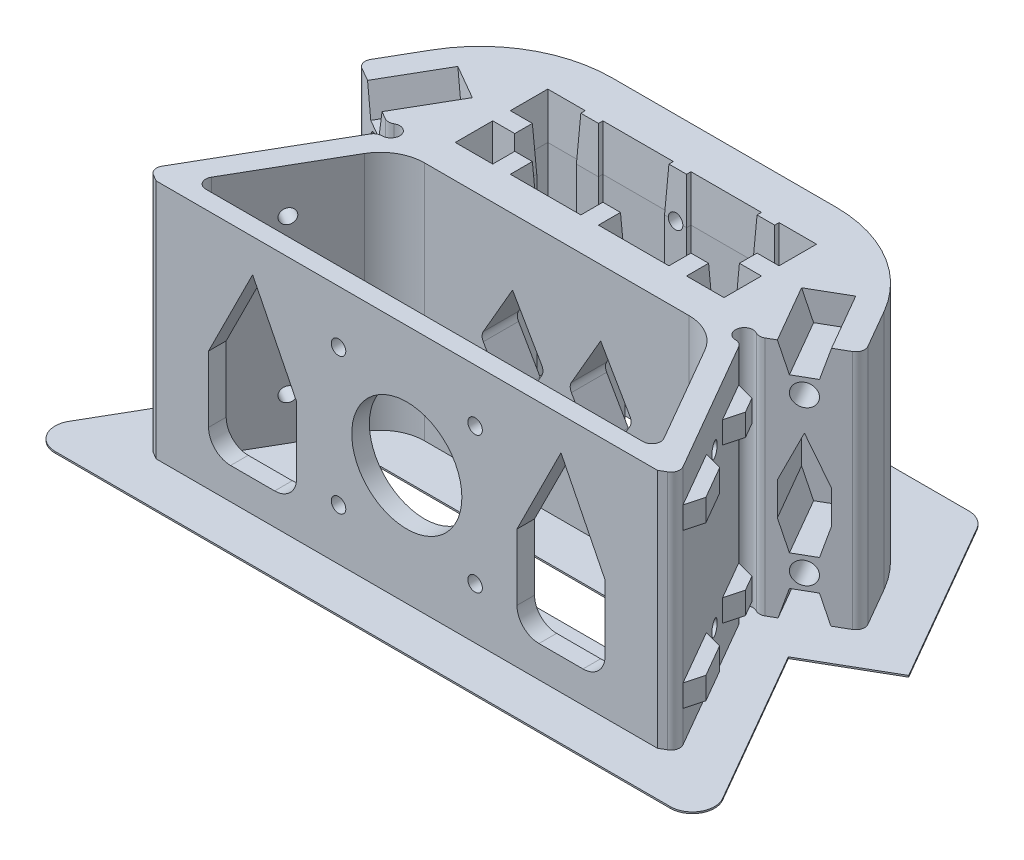
from build123d import *

# Parameters (mm, degrees)
BOSS_EXTRUDE1_DEPTH      = 55
SKETCH13_R               = 5
CUT_EXTRUDE7_DEPTH       = 106.913479808
SKETCH14_R               = 5
SKETCH14_R_2             = 2.5
BOSS_EXTRUDE8_DEPTH      = 16
CUT_EXTRUDE8_DEPTH       = 15
SKETCH16_W               = 14.535898385
SKETCH16_H               = 5
SKETCH16_W_2             = 10
BOSS_EXTRUDE9_DEPTH      = 3
CHAMFER2_SIZE            = 3
CUT_EXTRUDE9_REACH       = 121.348
SKETCH17_R               = 1.65
CHAMFER2_OF_MIRROR7_SIZE = 3
CUT_EXTRUDE10_REACH      = 111.206
SKETCH18_R               = 1.65
SKETCH19_R               = 6
CUT_EXTRUDE11_DEPTH      = 4
CUT_EXTRUDE12_REACH      = 91.963
SKETCH22_W               = 113.76755047
SKETCH22_H               = 0.641016151
CUT_EXTRUDE13_DEPTH      = 98.058374232
CUT_EXTRUDE14_REACH      = 110.781
SKETCH23_R               = 12.5
SKETCH23_R_2             = 1.65
FILLET1_R                = 5
BOSS_EXTRUDE10_DEPTH     = 0.35


with BuildPart() as part:
    # Sketch1 → Boss-Extrude1 (new body)
    with BuildSketch(Plane(origin=(0, 0, 0), x_dir=(1, 0, 0), z_dir=(0, 1, 0))):
        with BuildLine():
            Line((55.773502692, -52.641016151), (58.371578903, -51.141016151))
            ThreePointArc((58.371578903, -51.141016151), (59.303430556, -49.926603434), (59.103629711, -48.408965344))
            Line((59.103629711, -48.408965344), (41.835680518, -18.5))
            ThreePointArc((41.835680518, -18.5), (41.103629711, -17.767949192), (40.103629711, -17.5))
            ThreePointArc((40.103629711, -17.5), (38.171778058, -14.98236191), (41.103629711, -13.767949192))
            ThreePointArc((41.103629711, -13.767949192), (42.103629711, -14.035898385), (43.103629711, -13.767949192))
            Line((43.103629711, -13.767949192), (55.692086979, -6.5))
            ThreePointArc((55.692086979, -6.5), (56.623938632, -5.285587283), (56.424137787, -3.767949192))
            Line((56.424137787, -3.767949192), (51.36195996, 5))
            ThreePointArc((51.36195996, 5), (40.381197846, 15.980762114), (25.381197846, 20))
            Line((25.381197846, 20), (-25.381197846, 20))
            ThreePointArc((-25.381197846, 20), (-40.381197846, 15.980762114), (-51.36195996, 5))
            Line((-51.36195996, 5), (-56.424137787, -3.767949192))
            ThreePointArc((-56.424137787, -3.767949192), (-56.623938632, -5.285587283), (-55.692086979, -6.5))
            Line((-55.692086979, -6.5), (-43.103629711, -13.767949192))
            ThreePointArc((-43.103629711, -13.767949192), (-42.103629711, -14.035898385), (-41.103629711, -13.767949192))
            ThreePointArc((-41.103629711, -13.767949192), (-38.171778058, -14.98236191), (-40.103629711, -17.5))
            ThreePointArc((-40.103629711, -17.5), (-41.103629711, -17.767949192), (-41.835680518, -18.5))
            Line((-41.835680518, -18.5), (-59.103629711, -48.408965344))
            ThreePointArc((-59.103629711, -48.408965344), (-59.303430556, -49.926603434), (-58.371578903, -51.141016151))
            Line((-58.371578903, -51.141016151), (-55.773502692, -52.641016151))
            Line((-55.773502692, -52.641016151), (-55.692086979, -52.5))
            ThreePointArc((-55.692086979, -52.5), (-55.326061575, -52.133974596), (-54.826061575, -52))
            Line((-54.826061575, -52), (54.826061575, -52))
            ThreePointArc((54.826061575, -52), (55.326061575, -52.133974596), (55.692086979, -52.5))
            Line((55.692086979, -52.5), (55.773502692, -52.641016151))
        make_face()
        with BuildLine():
            Line((-30, -18), (30, -18))
            ThreePointArc((30, -18), (35, -19.339745962), (38.660254038, -23))
            Line((38.660254038, -23), (51.36195996, -45))
            ThreePointArc((51.36195996, -45), (51.36195996, -47), (49.629909152, -48))
            Line((49.629909152, -48), (-49.629909152, -48))
            ThreePointArc((-49.629909152, -48), (-51.36195996, -47), (-51.36195996, -45))
            Line((-51.36195996, -45), (-38.660254038, -23))
            ThreePointArc((-38.660254038, -23), (-35, -19.339745962), (-30, -18))
        make_face(mode=Mode.SUBTRACT)
        Polygon((-30, 10), (-22.5, 10), (-22.5, 9), (-17.5, 9), (-17.5, 10), (-2.5, 10), (-2.5, 9), (2.5, 9), (2.5, 10), (17.5, 10), (17.5, 9), (22.5, 9), (22.5, 10), (30, 10), (30, 2.5), (25, 2.5), (25, -2.5), (30, -2.5), (30, -10), (22.5, -10), (22.5, -5), (17.5, -5), (17.5, -10), (2.5, -10), (2.5, -5), (-2.5, -5), (-2.5, -10), (-17.5, -10), (-17.5, -5), (-22.5, -5), (-22.5, -10), (-30, -10), (-30, -2.5), (-25, -2.5), (-25, 2.5), (-30, 2.5), align=None, mode=Mode.SUBTRACT)
    extrude(amount=BOSS_EXTRUDE1_DEPTH)

    # Sketch13 → Cut-Extrude7 (cut, through all)
    with BuildSketch(Plane(origin=(16.737604307, 0, 28.990381057), x_dir=(0.8660254037844353, 0, -0.500000000000006), z_dir=(0.500000000000006, 0, 0.8660254037844353))):
        with Locations((36.980762114, 10)):
            Circle(SKETCH13_R)
        with Locations((36.980762114, 45)):
            Circle(SKETCH13_R)
    cut_extrude7 = extrude(amount=-CUT_EXTRUDE7_DEPTH, mode=Mode.SUBTRACT)

    # Sketch14 → Boss-Extrude8 (add)
    # profile 1 of 2: a face of its own
    with BuildSketch(Plane(origin=(16.737604307, 0, 28.990381057), x_dir=(0.8660254037844353, 0, -0.500000000000006), z_dir=(0.500000000000006, 0, 0.8660254037844353))):
        with Locations((36.980762114, 45)):
            Circle(SKETCH14_R)
        with Locations((36.980762114, 45)):
            Circle(SKETCH14_R_2, mode=Mode.SUBTRACT)
    # profile 2 of 2: a face of its own
    with BuildSketch(Plane(origin=(16.737604307, 0, 28.990381057), x_dir=(0.8660254037844353, 0, -0.500000000000006), z_dir=(0.500000000000006, 0, 0.8660254037844353))):
        with Locations((36.980762114, 10)):
            Circle(SKETCH14_R)
        with Locations((36.980762114, 10)):
            Circle(SKETCH14_R_2, mode=Mode.SUBTRACT)
    boss_extrude8 = extrude(amount=-BOSS_EXTRUDE8_DEPTH)

    # Sketch15 → Cut-Extrude8 (cut)
    with BuildSketch(Plane(origin=(16.737604307, 0, 28.990381057), x_dir=(0.8660254037844353, 0, -0.500000000000006), z_dir=(0.500000000000006, 0, 0.8660254037844353))):
        Polygon((32.480762114, 55), (34.480762114, 48.5), (39.480762114, 48.5), (41.480762114, 55), align=None)
        Polygon((39.480762114, 6.5), (41.480762114, 0), (32.480762114, 0), (34.480762114, 6.5), align=None)
        Polygon((41.480762114, 20), (41.480762114, 27.5), (36.980762114, 37.5), (32.480762114, 27.5), (32.480762114, 20), (34.480762114, 13.5), (39.480762114, 13.5), align=None)
    cut_extrude8 = extrude(amount=-CUT_EXTRUDE8_DEPTH, mode=Mode.SUBTRACT)

    # Sketch16 → Boss-Extrude9 (add)
    with BuildSketch(Plane(origin=(23.366025404, 0, -13.490381057), x_dir=(-0.5000000000000017, 0, -0.8660254037844377), z_dir=(0.8660254037844377, 0, -0.5000000000000017))):
        with Locations((-64.207259421, 10)):
            Rectangle(SKETCH16_W, SKETCH16_H)
        with Locations((-41.939310229, 10)):
            Rectangle(SKETCH16_W_2, SKETCH16_H)
        with Locations((-64.207259421, 45)):
            Rectangle(SKETCH16_W, SKETCH16_H)
        with Locations((-41.939310229, 45)):
            Rectangle(SKETCH16_W_2, SKETCH16_H)
    boss_extrude9 = extrude(amount=BOSS_EXTRUDE9_DEPTH)

    # Chamfer2
    chamfer2_edges = [part.edges().sort_by_distance(p)[0] for p in [
        (44.43375673, 45, 17),
        (44.43375673, 10, 17),
        (49.43375673, 10, 25.660254038),
        (49.43375673, 45, 25.660254038),
        (54.43375673, 45, 34.320508076),
        (54.43375673, 10, 34.320508076),
        (61.701705922, 10, 46.908965344),
        (61.701705922, 45, 46.908965344),
    ]]
    chamfer(chamfer2_edges, length=CHAMFER2_SIZE - 0.0001)  # a hair under: the kernel refuses the full size

    # Sketch17 → Cut-Extrude9 (cut, up to next)
    with BuildSketch(Plane(origin=(23.366025404, 0, -13.490381057), x_dir=(-0.5000000000000017, 0, -0.8660254037844377), z_dir=(0.8660254037844377, 0, -0.5000000000000017)), mode=Mode.PRIVATE) as cut_extrude9_sk1:
        with Locations((-51.939310229, 10)):
            Circle(SKETCH17_R)
    cut_extrude9_tool1 = extrude(cut_extrude9_sk1.sketch, amount=-CUT_EXTRUDE9_REACH, mode=Mode.PRIVATE) & part.part
    # Sketch17 → Cut-Extrude9 (cut, up to next)
    with BuildSketch(Plane(origin=(23.366025404, 0, -13.490381057), x_dir=(-0.5000000000000017, 0, -0.8660254037844377), z_dir=(0.8660254037844377, 0, -0.5000000000000017)), mode=Mode.PRIVATE) as cut_extrude9_sk2:
        with Locations((-51.939310229, 45)):
            Circle(SKETCH17_R)
    cut_extrude9_tool2 = extrude(cut_extrude9_sk2.sketch, amount=-CUT_EXTRUDE9_REACH, mode=Mode.PRIVATE) & part.part
    cut_extrude9_1 = cut_extrude9_tool1.solids().sort_by_distance((49.335681, 10, 31.490381))[0]
    add(cut_extrude9_1, mode=Mode.SUBTRACT)
    cut_extrude9_2 = cut_extrude9_tool2.solids().sort_by_distance((49.335681, 45, 31.490381))[0]
    add(cut_extrude9_2, mode=Mode.SUBTRACT)
    cut_extrude9 = cut_extrude9_1 + cut_extrude9_2  # Cut-Extrude9 as one shape, for the pattern or mirror that repeats it

    # Mirror7: Cut-Extrude7, Boss-Extrude8, Cut-Extrude8, Boss-Extrude9, Cut-Extrude9 across plane
    add(cut_extrude7.mirror(Plane(origin=(0, 0, 0), x_dir=(0, 0, 1), z_dir=(1, 0, 0))), mode=Mode.SUBTRACT)
    add(boss_extrude8.mirror(Plane(origin=(0, 0, 0), x_dir=(0, 0, 1), z_dir=(1, 0, 0))))
    add(cut_extrude8.mirror(Plane(origin=(0, 0, 0), x_dir=(0, 0, 1), z_dir=(1, 0, 0))), mode=Mode.SUBTRACT)
    add(boss_extrude9.mirror(Plane(origin=(0, 0, 0), x_dir=(0, 0, 1), z_dir=(1, 0, 0))))
    add(cut_extrude9.mirror(Plane(origin=(0, 0, 0), x_dir=(0, 0, 1), z_dir=(1, 0, 0))), mode=Mode.SUBTRACT)

    # Chamfer2 of Mirror7
    chamfer2_of_mirror7_edges = [part.edges().sort_by_distance(p)[0] for p in [
        (-44.43375673, 45, 17),
        (-44.43375673, 10, 17),
        (-49.43375673, 10, 25.660254038),
        (-49.43375673, 45, 25.660254038),
        (-54.43375673, 45, 34.320508076),
        (-54.43375673, 10, 34.320508076),
        (-61.701705922, 10, 46.908965344),
        (-61.701705922, 45, 46.908965344),
    ]]
    chamfer(chamfer2_of_mirror7_edges, length=CHAMFER2_OF_MIRROR7_SIZE - 0.0001)  # a hair under: the kernel refuses the full size

    # Sketch18 → Cut-Extrude10 (cut, up to next)
    with BuildSketch(Plane(origin=(0, 0, -20), x_dir=(-1, 0, 0), z_dir=(0, 0, -1)), mode=Mode.PRIVATE) as cut_extrude10_sk1:
        with Locations((0, 45)):
            Circle(SKETCH18_R)
    cut_extrude10_tool1 = extrude(cut_extrude10_sk1.sketch, amount=-CUT_EXTRUDE10_REACH, mode=Mode.PRIVATE) & part.part
    # Sketch18 → Cut-Extrude10 (cut, up to next)
    with BuildSketch(Plane(origin=(0, 0, -20), x_dir=(-1, 0, 0), z_dir=(0, 0, -1)), mode=Mode.PRIVATE) as cut_extrude10_sk2:
        with Locations((0, 10)):
            Circle(SKETCH18_R)
    cut_extrude10_tool2 = extrude(cut_extrude10_sk2.sketch, amount=-CUT_EXTRUDE10_REACH, mode=Mode.PRIVATE) & part.part
    # Sketch18 → Cut-Extrude10 (cut, up to next)
    with BuildSketch(Plane(origin=(0, 0, -20), x_dir=(-1, 0, 0), z_dir=(0, 0, -1)), mode=Mode.PRIVATE) as cut_extrude10_sk3:
        with Locations((-20, 27.5)):
            Circle(SKETCH18_R)
    cut_extrude10_tool3 = extrude(cut_extrude10_sk3.sketch, amount=-CUT_EXTRUDE10_REACH, mode=Mode.PRIVATE) & part.part
    # Sketch18 → Cut-Extrude10 (cut, up to next)
    with BuildSketch(Plane(origin=(0, 0, -20), x_dir=(-1, 0, 0), z_dir=(0, 0, -1)), mode=Mode.PRIVATE) as cut_extrude10_sk4:
        with Locations((20, 27.5)):
            Circle(SKETCH18_R)
    cut_extrude10_tool4 = extrude(cut_extrude10_sk4.sketch, amount=-CUT_EXTRUDE10_REACH, mode=Mode.PRIVATE) & part.part
    add(cut_extrude10_tool1.solids().sort_by_distance((0, 45, -20))[0], mode=Mode.SUBTRACT)
    add(cut_extrude10_tool2.solids().sort_by_distance((0, 10, -20))[0], mode=Mode.SUBTRACT)
    add(cut_extrude10_tool3.solids().sort_by_distance((20, 27.5, -20))[0], mode=Mode.SUBTRACT)
    add(cut_extrude10_tool4.solids().sort_by_distance((-20, 27.5, -20))[0], mode=Mode.SUBTRACT)

    # Sketch19 → Cut-Extrude11 (cut)
    with BuildSketch(Plane(origin=(0, 0, -20), x_dir=(-1, 0, 0), z_dir=(0, 0, -1))):
        with Locations((0, 45)):
            Circle(SKETCH19_R)
        with Locations(Location((20, 27.5, 0), (0, 0, 26.250833445))):
            Circle(SKETCH19_R)
        with Locations((0, 10)):
            Circle(SKETCH19_R)
        with Locations(Location((-20, 27.5, 0), (0, 0, 206.250833445))):
            Circle(SKETCH19_R)
    extrude(amount=-CUT_EXTRUDE11_DEPTH, mode=Mode.SUBTRACT)

    # Sketch20 → Cut-Extrude12 (cut, up to next)
    with BuildSketch(Plane.XY.offset(18), mode=Mode.PRIVATE) as cut_extrude12_sk1:
        with BuildLine():
            Line((-10, 40), (-16.639528096, 28.5))
            ThreePointArc((-16.639528096, 28.5), (-16.907477288, 27.5), (-16.639528096, 26.5))
            Line((-16.639528096, 26.5), (-11.732050808, 18))
            ThreePointArc((-11.732050808, 18), (-10, 17), (-8.267949192, 18))
            Line((-8.267949192, 18), (-3.360471904, 26.5))
            ThreePointArc((-3.360471904, 26.5), (-3.092522712, 27.5), (-3.360471904, 28.5))
            Line((-3.360471904, 28.5), (-10, 40))
        make_face()
    cut_extrude12_tool1 = extrude(cut_extrude12_sk1.sketch, amount=-CUT_EXTRUDE12_REACH, mode=Mode.PRIVATE) & part.part
    # Sketch20 → Cut-Extrude12 (cut, up to next)
    with BuildSketch(Plane.XY.offset(18), mode=Mode.PRIVATE) as cut_extrude12_sk2:
        with BuildLine():
            Line((3.360471904, 28.5), (10, 40))
            Line((10, 40), (16.639528096, 28.5))
            ThreePointArc((16.639528096, 28.5), (16.907477288, 27.5), (16.639528096, 26.5))
            Line((16.639528096, 26.5), (11.732050808, 18))
            ThreePointArc((11.732050808, 18), (10, 17), (8.267949192, 18))
            Line((8.267949192, 18), (3.360471904, 26.5))
            ThreePointArc((3.360471904, 26.5), (3.092522712, 27.5), (3.360471904, 28.5))
        make_face()
    cut_extrude12_tool2 = extrude(cut_extrude12_sk2.sketch, amount=-CUT_EXTRUDE12_REACH, mode=Mode.PRIVATE) & part.part
    add(cut_extrude12_tool1.solids().sort_by_distance((-10, 27.670453, 18))[0], mode=Mode.SUBTRACT)
    add(cut_extrude12_tool2.solids().sort_by_distance((10, 27.670453, 18))[0], mode=Mode.SUBTRACT)

    # Sketch22 → Cut-Extrude13 (cut, through all)
    with BuildSketch(Plane(origin=(0, 55, 0), x_dir=(1, 0, 0), z_dir=(0, 1, 0))):
        with Locations((0, -52.320508076)):
            Rectangle(SKETCH22_W, SKETCH22_H)
    extrude(amount=-CUT_EXTRUDE13_DEPTH, mode=Mode.SUBTRACT)

    # Sketch23 → Cut-Extrude14 (cut, up to next)
    with BuildSketch(Plane.XY.offset(52), mode=Mode.PRIVATE) as cut_extrude14_sk1:
        with Locations((0, 27.5)):
            Circle(SKETCH23_R)
    cut_extrude14_tool1 = extrude(cut_extrude14_sk1.sketch, amount=-CUT_EXTRUDE14_REACH, mode=Mode.PRIVATE) & part.part
    # Sketch23 → Cut-Extrude14 (cut, up to next)
    with BuildSketch(Plane.XY.offset(52), mode=Mode.PRIVATE) as cut_extrude14_sk2:
        with Locations((-15.5, 12)):
            Circle(SKETCH23_R_2)
    cut_extrude14_tool2 = extrude(cut_extrude14_sk2.sketch, amount=-CUT_EXTRUDE14_REACH, mode=Mode.PRIVATE) & part.part
    # Sketch23 → Cut-Extrude14 (cut, up to next)
    with BuildSketch(Plane.XY.offset(52), mode=Mode.PRIVATE) as cut_extrude14_sk3:
        with Locations((15.5, 12)):
            Circle(SKETCH23_R_2)
    cut_extrude14_tool3 = extrude(cut_extrude14_sk3.sketch, amount=-CUT_EXTRUDE14_REACH, mode=Mode.PRIVATE) & part.part
    # Sketch23 → Cut-Extrude14 (cut, up to next)
    with BuildSketch(Plane.XY.offset(52), mode=Mode.PRIVATE) as cut_extrude14_sk4:
        with Locations((15.5, 43)):
            Circle(SKETCH23_R_2)
    cut_extrude14_tool4 = extrude(cut_extrude14_sk4.sketch, amount=-CUT_EXTRUDE14_REACH, mode=Mode.PRIVATE) & part.part
    # Sketch23 → Cut-Extrude14 (cut, up to next)
    with BuildSketch(Plane.XY.offset(52), mode=Mode.PRIVATE) as cut_extrude14_sk5:
        with Locations((-15.5, 43)):
            Circle(SKETCH23_R_2)
    cut_extrude14_tool5 = extrude(cut_extrude14_sk5.sketch, amount=-CUT_EXTRUDE14_REACH, mode=Mode.PRIVATE) & part.part
    # Sketch23 → Cut-Extrude14 (cut, up to next)
    with BuildSketch(Plane.XY.offset(52), mode=Mode.PRIVATE) as cut_extrude14_sk6:
        Polygon((35, 47.5), (45, 27.5), (45, 7.5), (25, 7.5), (25, 27.5), align=None)
    cut_extrude14_tool6 = extrude(cut_extrude14_sk6.sketch, amount=-CUT_EXTRUDE14_REACH, mode=Mode.PRIVATE) & part.part
    # Sketch23 → Cut-Extrude14 (cut, up to next)
    with BuildSketch(Plane.XY.offset(52), mode=Mode.PRIVATE) as cut_extrude14_sk7:
        Polygon((-45, 27.5), (-45, 7.5), (-25, 7.5), (-25, 27.5), (-35, 47.5), align=None)
    cut_extrude14_tool7 = extrude(cut_extrude14_sk7.sketch, amount=-CUT_EXTRUDE14_REACH, mode=Mode.PRIVATE) & part.part
    add(cut_extrude14_tool1.solids().sort_by_distance((0, 27.5, 52))[0], mode=Mode.SUBTRACT)
    add(cut_extrude14_tool2.solids().sort_by_distance((-15.5, 12, 52))[0], mode=Mode.SUBTRACT)
    add(cut_extrude14_tool3.solids().sort_by_distance((15.5, 12, 52))[0], mode=Mode.SUBTRACT)
    add(cut_extrude14_tool4.solids().sort_by_distance((15.5, 43, 52))[0], mode=Mode.SUBTRACT)
    add(cut_extrude14_tool5.solids().sort_by_distance((-15.5, 43, 52))[0], mode=Mode.SUBTRACT)
    add(cut_extrude14_tool6.solids().sort_by_distance((35, 23.055556, 52))[0], mode=Mode.SUBTRACT)
    add(cut_extrude14_tool7.solids().sort_by_distance((-35, 23.055556, 52))[0], mode=Mode.SUBTRACT)

    # Fillet1
    fillet1_edges = [part.edges().sort_by_distance(p)[0] for p in [
        (45, 7.5, 50),
        (25, 7.5, 50),
        (-25, 7.5, 50),
        (-45, 7.5, 50),
    ]]
    fillet(fillet1_edges, radius=FILLET1_R)

    # Chamfer3: read off the stored shape, not the designer's step
    # Chamfer3: loft between two sections, ruled curve by curve
    chamfer3_from = [
        Edge.make_line((30, 45, 10), (30, 45, 2.5)),
        Edge.make_line((30, 45, -2.5), (30, 45, -10)),
        Edge.make_line((30, 45, 2.5), (25, 45, 2.5)),
        Edge.make_line((-30, 45, 2.5), (-25, 45, 2.5)),
        Edge.make_line((30, 45, 10), (22.5, 45, 10)),
        Edge.make_line((17.5, 45, 10), (2.5, 45, 10)),
        Edge.make_line((-2.5, 45, 10), (-17.5, 45, 10)),
        Edge.make_line((-22.5, 45, 10), (-30, 45, 10)),
        Edge.make_line((25, 45, 2.5), (25, 45, -2.5)),
        Edge.make_line((22.5, 45, 10), (22.5, 45, 5)),
        Edge.make_line((22.5, 45, -10), (22.5, 45, -9)),
        Edge.make_line((25, 45, -2.5), (30, 45, -2.5)),
        Edge.make_line((-25, 45, -2.5), (-30, 45, -2.5)),
        Edge.make_line((22.5, 45, 5), (17.5, 45, 5)),
        Edge.make_line((2.5, 45, 5), (-2.5, 45, 5)),
        Edge.make_line((-17.5, 45, 5), (-22.5, 45, 5)),
        Edge.make_line((17.5, 45, 5), (17.5, 45, 10)),
        Edge.make_line((17.5, 45, -9), (17.5, 45, -10)),
        Edge.make_line((30, 45, -10), (22.5, 45, -10)),
        Edge.make_line((17.5, 45, -10), (2.5, 45, -10)),
        Edge.make_line((-2.5, 45, -10), (-17.5, 45, -10)),
        Edge.make_line((-22.5, 45, -10), (-30, 45, -10)),
        Edge.make_line((2.5, 45, 10), (2.5, 45, 5)),
        Edge.make_line((2.5, 45, -10), (2.5, 45, -9)),
        Edge.make_line((22.5, 45, -9), (17.5, 45, -9)),
        Edge.make_line((-17.5, 45, -9), (-22.5, 45, -9)),
        Edge.make_line((-2.5, 45, 5), (-2.5, 45, 10)),
        Edge.make_line((-2.5, 45, -9), (-2.5, 45, -10)),
        Edge.make_line((-17.5, 45, 10), (-17.5, 45, 5)),
        Edge.make_line((-17.5, 45, -10), (-17.5, 45, -9)),
        Edge.make_line((-22.5, 45, 5), (-22.5, 45, 10)),
        Edge.make_line((-22.5, 45, -9), (-22.5, 45, -10)),
        Edge.make_line((-30, 45, 10), (-30, 45, 2.5)),
        Edge.make_line((-30, 45, -10), (-30, 45, -2.5)),
        Edge.make_line((-25, 45, 2.5), (-25, 45, -2.5)),
        Edge.make_line((-2.5, 45, -9), (2.5, 45, -9)),
    ]
    chamfer3_to = [
        Edge.make_line((30.5, 55, 10.5), (30.5, 55, 2)),
        Edge.make_line((30.5, 55, -2), (30.5, 55, -10.5)),
        Edge.make_line((30.5, 55, 2), (25.5, 55, 2)),
        Edge.make_line((-30.5, 55, 2), (-25.5, 55, 2)),
        Edge.make_line((30.5, 55, 10.5), (22, 55, 10.5)),
        Edge.make_line((18, 55, 10.5), (2, 55, 10.5)),
        Edge.make_line((-2, 55, 10.5), (-18, 55, 10.5)),
        Edge.make_line((-22, 55, 10.5), (-30.5, 55, 10.5)),
        Edge.make_line((25.5, 55, 2), (25.5, 55, -2)),
        Edge.make_line((22, 55, 10.5), (22, 55, 5.5)),
        Edge.make_line((22, 55, -10.5), (22, 55, -9.5)),
        Edge.make_line((25.5, 55, -2), (30.5, 55, -2)),
        Edge.make_line((-25.5, 55, -2), (-30.5, 55, -2)),
        Edge.make_line((22, 55, 5.5), (18, 55, 5.5)),
        Edge.make_line((2, 55, 5.5), (-2, 55, 5.5)),
        Edge.make_line((-18, 55, 5.5), (-22, 55, 5.5)),
        Edge.make_line((18, 55, 5.5), (18, 55, 10.5)),
        Edge.make_line((18, 55, -9.5), (18, 55, -10.5)),
        Edge.make_line((30.5, 55, -10.5), (22, 55, -10.5)),
        Edge.make_line((18, 55, -10.5), (2, 55, -10.5)),
        Edge.make_line((-2, 55, -10.5), (-18, 55, -10.5)),
        Edge.make_line((-22, 55, -10.5), (-30.5, 55, -10.5)),
        Edge.make_line((2, 55, 10.5), (2, 55, 5.5)),
        Edge.make_line((2, 55, -10.5), (2, 55, -9.5)),
        Edge.make_line((22, 55, -9.5), (18, 55, -9.5)),
        Edge.make_line((-18, 55, -9.5), (-22, 55, -9.5)),
        Edge.make_line((-2, 55, 5.5), (-2, 55, 10.5)),
        Edge.make_line((-2, 55, -9.5), (-2, 55, -10.5)),
        Edge.make_line((-18, 55, 10.5), (-18, 55, 5.5)),
        Edge.make_line((-18, 55, -10.5), (-18, 55, -9.5)),
        Edge.make_line((-22, 55, 5.5), (-22, 55, 10.5)),
        Edge.make_line((-22, 55, -9.5), (-22, 55, -10.5)),
        Edge.make_line((-30.5, 55, 10.5), (-30.5, 55, 2)),
        Edge.make_line((-30.5, 55, -10.5), (-30.5, 55, -2)),
        Edge.make_line((-25.5, 55, 2), (-25.5, 55, -2)),
        Edge.make_line((-2, 55, -9.5), (2, 55, -9.5)),
    ]
    chamfer3 = Solid(Shell([*[Face.make_surface_from_curves(chamfer3_from[k], chamfer3_to[k]) for k in range(36)], Face(Wire(chamfer3_from)), Face(Wire(chamfer3_to))]))
    add(chamfer3, mode=Mode.SUBTRACT)

    # Sketch25 → Boss-Extrude10 (add)
    with BuildSketch(Plane(origin=(0, 0, 0), x_dir=(1, 0, 0), z_dir=(0, 1, 0))):
        with BuildLine():
            Line((-69.837168574, -62), (69.837168574, -62))
            ThreePointArc((69.837168574, -62), (74.167295593, -59.5), (74.167295593, -54.5))
            Line((74.167295593, -54.5), (53.763883749, -19.160254038))
            Line((53.763883749, -19.160254038), (71.084391824, -9.160254038))
            Line((71.084391824, -9.160254038), (49.918584287, 27.5))
            ThreePointArc((49.918584287, 27.5), (48.088457268, 29.330127019), (45.588457268, 30))
            Line((45.588457268, 30), (-45.588457268, 30))
            ThreePointArc((-45.588457268, 30), (-48.088457268, 29.330127019), (-49.918584287, 27.5))
            Line((-49.918584287, 27.5), (-71.084391824, -9.160254038))
            Line((-71.084391824, -9.160254038), (-53.763883749, -19.160254038))
            Line((-53.763883749, -19.160254038), (-74.167295593, -54.5))
            ThreePointArc((-74.167295593, -54.5), (-74.167295593, -59.5), (-69.837168574, -62))
        make_face()
        Polygon((-30, 10), (-30, 2.5), (-25, 2.5), (-25, -2.5), (-30, -2.5), (-30, -10), (-22.5, -10), (-22.5, -5), (-17.5, -5), (-17.5, -10), (-2.5, -10), (-2.5, -5), (2.5, -5), (2.5, -10), (17.5, -10), (17.5, -5), (22.5, -5), (22.5, -10), (30, -10), (30, -2.5), (25, -2.5), (25, 2.5), (30, 2.5), (30, 10), (22.5, 10), (22.5, 9), (17.5, 9), (17.5, 10), (2.5, 10), (2.5, 9), (1.65, 9), (-1.65, 9), (-2.5, 9), (-2.5, 10), (-17.5, 10), (-17.5, 9), (-22.5, 9), (-22.5, 10), align=None, mode=Mode.SUBTRACT)
        Polygon((-35.773502692, -38), (35.773502692, -38), (30, -28), (-30, -28), align=None, mode=Mode.SUBTRACT)
    extrude(amount=BOSS_EXTRUDE10_DEPTH)


solid = part.part
